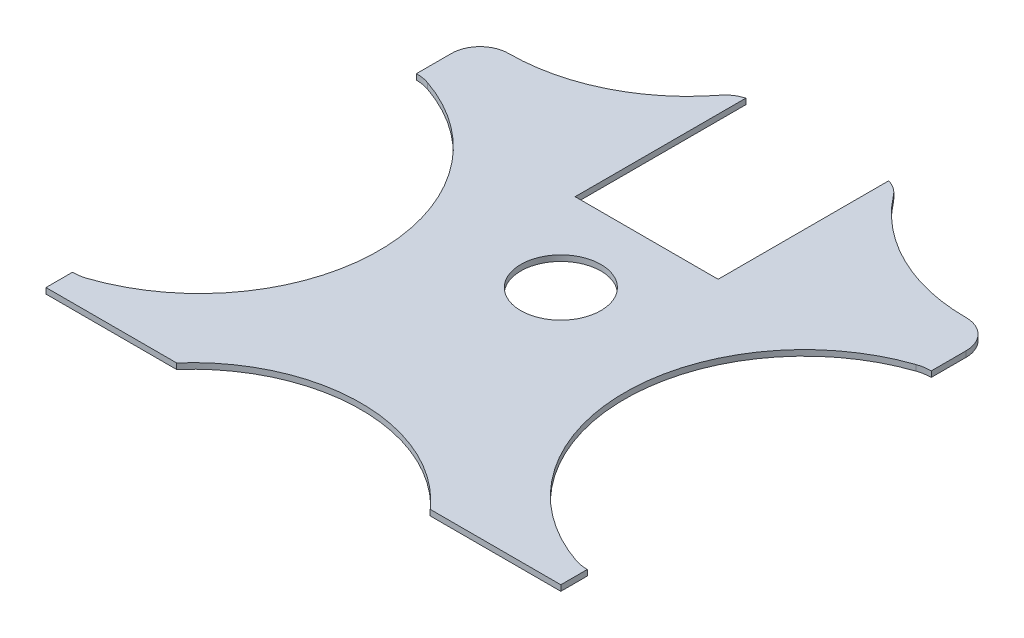
from build123d import *

# Parameters (mm, degrees)
SKETCH1_W               = 180
SKETCH1_H               = 180
BOSS_EXTRUDE1_DEPTH     = 2
SKETCH4_W               = 50
SKETCH4_H               = 60
CUT_EXTRUDE2_DEPTH      = 2
CUT_EXTRUDE3_DEPTH      = 10
CUT_EXTRUDE4_DEPTH      = 128.294933128
CUT_EXTRUDE4_DEPTH_BACK = 128.294933128
SKETCH2_R               = 14
CUT_EXTRUDE6_DEPTH      = 3


with BuildPart() as part:
    # Sketch1 → Boss-Extrude1 (new body)
    with BuildSketch(Plane(origin=(0, 0, 0), x_dir=(1, 0, 0), z_dir=(0, 1, 0))):
        Rectangle(SKETCH1_W, SKETCH1_H)
    extrude(amount=BOSS_EXTRUDE1_DEPTH)

    # Sketch4 → Cut-Extrude2 (cut)
    with BuildSketch(Plane(origin=(0, 2, 0), x_dir=(1, 0, 0), z_dir=(0, 1, 0))):
        with Locations((0, 60)):
            Rectangle(SKETCH4_W, SKETCH4_H)
    extrude(amount=-CUT_EXTRUDE2_DEPTH, mode=Mode.SUBTRACT)

    # Sketch5 → Cut-Extrude3 (cut)
    with BuildSketch(Plane(origin=(0, 2, 0), x_dir=(-1, 0, 0), z_dir=(0, 1, 0))):
        with BuildLine():
            Line((94.631089608, -11.725582288), (94.631089608, 52.958947453))
            ThreePointArc((94.631089608, 52.958947453), (103.51498491, 71.105021971), (85.368910392, 79.988917274))
            ThreePointArc((85.368910392, 79.988917274), (42.952394939, 20.616682583), (85.368910392, -38.755552108))
            ThreePointArc((85.368910392, -38.755552108), (103.51498491, -29.871656806), (94.631089608, -11.725582288))
        make_face()
    cut_extrude3 = extrude(amount=-CUT_EXTRUDE3_DEPTH, mode=Mode.SUBTRACT)

    # Mirror2: Cut-Extrude3 across plane
    add(cut_extrude3.mirror(Plane(origin=(0, 0, 0), x_dir=(0, 0, 1), z_dir=(1, 0, 0))), mode=Mode.SUBTRACT)

    # Sketch6 → Cut-Extrude4 (cut, two sides: drawn at the far end of the back side and taken through both)
    with BuildSketch(Plane(origin=(0, 2, 0), x_dir=(1, 0, 0), z_dir=(0, 1, 0)).offset(-CUT_EXTRUDE4_DEPTH_BACK)):
        with BuildLine():
            Line((-347.028246849, -435.32558628), (-44.338126834, -90))
            ThreePointArc((-44.338126834, -90), (0, -69.903993293), (44.338126834, -90))
            Line((44.338126834, -90), (347.028246849, -435.32558628))
            Line((347.028246849, -435.32558628), (347.028246849, -1353.73958725))
            Line((347.028246849, -1353.73958725), (-347.028246849, -1353.73958725))
            Line((-347.028246849, -1353.73958725), (-347.028246849, -435.32558628))
        make_face()
    extrude(amount=CUT_EXTRUDE4_DEPTH + CUT_EXTRUDE4_DEPTH_BACK, mode=Mode.SUBTRACT)

    # Sketch2 → Cut-Extrude6 (cut)
    with BuildSketch(Plane(origin=(0, 2, 0), x_dir=(-1, 0, 0), z_dir=(0, 1, 0))):
        Circle(SKETCH2_R)
        with BuildLine():
            Line((-22.28331281, -90), (-90, -90))
            Line((-90, -90), (-90, -51.741755227))
            ThreePointArc((-90, -51.741755227), (-87.062465996, -58.821414404), (-79.975685188, -61.741725666))
            ThreePointArc((-79.975685188, -61.741725666), (-52.247626752, -68.129791608), (-30.196860935, -86.113571466))
            ThreePointArc((-30.196860935, -86.113571466), (-26.691503217, -88.975959967), (-22.28331281, -90))
        make_face()
        with BuildLine():
            Line((90, -51.741726259), (90, -90))
            Line((90, -90), (22.435206222, -90))
            ThreePointArc((22.435206222, -90), (26.843382461, -88.975966926), (30.348735046, -86.11359645))
            ThreePointArc((30.348735046, -86.11359645), (52.340708927, -68.158736597), (79.996556017, -61.741725666))
            ThreePointArc((79.996556017, -61.741725666), (87.069850075, -58.814011598), (90, -51.741726259))
        make_face()
    extrude(amount=-CUT_EXTRUDE6_DEPTH, mode=Mode.SUBTRACT)


solid = part.part
